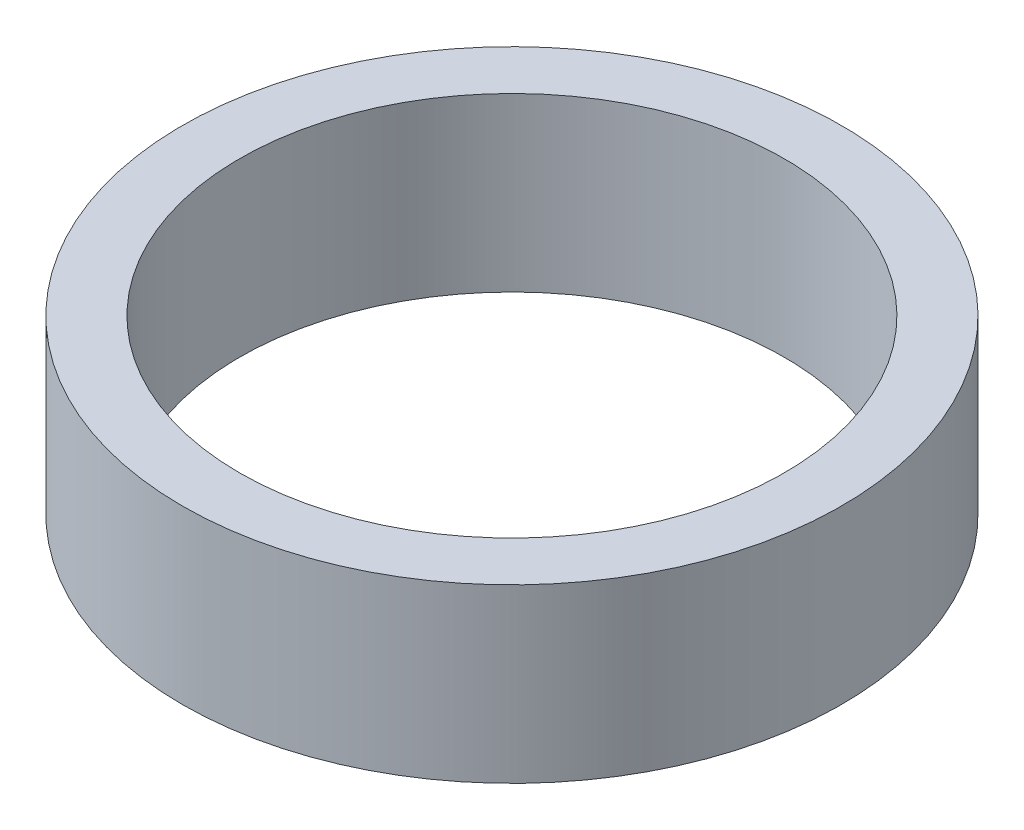
from build123d import *

# Parameters (mm, degrees)
SKETCH1_R           = 57.5
BOSS_EXTRUDE1_DEPTH = 30
SKETCH2_R           = 47.5
CUT_EXTRUDE1_DEPTH  = 87.674679117


with BuildPart() as part:
    # Sketch1 → Boss-Extrude1 (new body)
    with BuildSketch(Plane(origin=(0, 0, 0), x_dir=(1, 0, 0), z_dir=(0, 1, 0))):
        Circle(SKETCH1_R)
    extrude(amount=BOSS_EXTRUDE1_DEPTH)

    # Sketch2 → Cut-Extrude1 (cut, through all)
    with BuildSketch(Plane(origin=(0, 0, 0), x_dir=(1, 0, 0), z_dir=(0, 1, 0))):
        Circle(SKETCH2_R)
    extrude(amount=CUT_EXTRUDE1_DEPTH, mode=Mode.SUBTRACT)


solid = part.part
